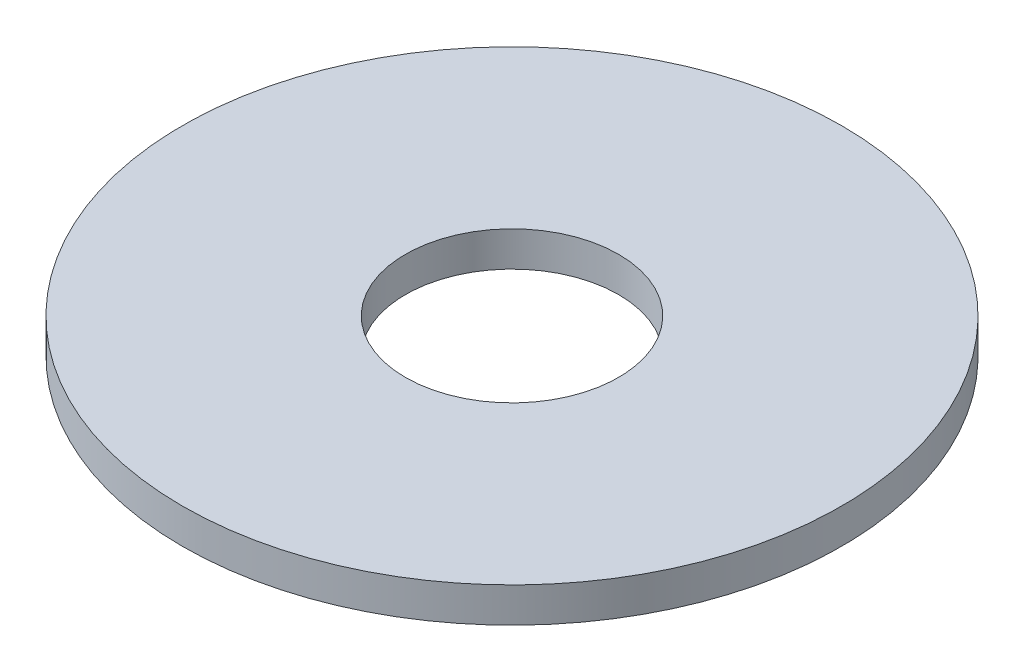
from build123d import *

# Parameters (mm, degrees)
SKETCH1_R           = 85
BOSS_EXTRUDE1_DEPTH = 9
SKETCH2_R           = 27.5
CUT_EXTRUDE1_DEPTH  = 121.544597556


with BuildPart() as part:
    # Sketch1 → Boss-Extrude1 (new body)
    with BuildSketch(Plane(origin=(0, 0, 0), x_dir=(1, 0, 0), z_dir=(0, 1, 0))):
        Circle(SKETCH1_R)
    extrude(amount=BOSS_EXTRUDE1_DEPTH)

    # Sketch2 → Cut-Extrude1 (cut, through all)
    with BuildSketch(Plane(origin=(0, 0, 0), x_dir=(1, 0, 0), z_dir=(0, 1, 0))):
        Circle(SKETCH2_R)
    extrude(amount=CUT_EXTRUDE1_DEPTH, mode=Mode.SUBTRACT)


solid = part.part
